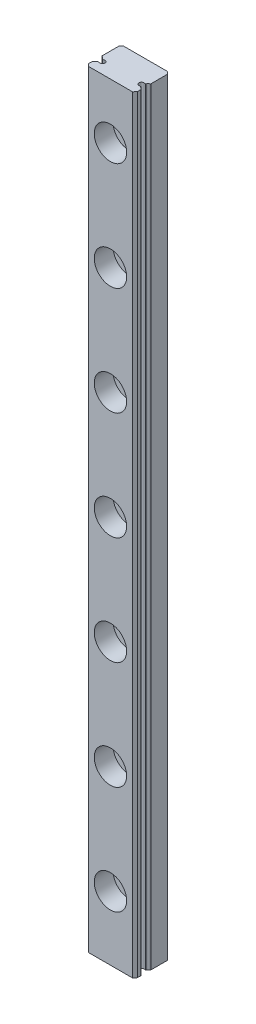
from build123d import *

# Parameters (mm, degrees)
RESSALTO_EXTRUS_O1_DEPTH                             = 1000
CORTE_EXTRUS_O1_START                                = -1000
CORTE_EXTRUS_O1_DEPTH                                = 1000
CORTE_EXTRUS_O2_DEPTH                                = 1001.031261626
CORTE_EXTRUS_O3_DEPTH                                = 1001.031261626
CORTE_EXTRUS_O4_DEPTH                                = 1001.031261626
CORTE_EXTRUS_O5_DEPTH                                = 0.002166667
CORTE_EXTRUS_O6_DEPTH                                = 0.002166667
CORTE_EXTRUS_O7_DEPTH                                = 0.002166667
CORTE_EXTRUS_O8_DEPTH                                = 0.002166667
INCLINA_O1_ANGLE                                     = 45.1469538
ESBO_O10_W                                           = 0.450000001
ESBO_O10_H                                           = 1000
REBAIXO_PARA_PARAFUSO_DE_M_QUINA_DE_CABE_D           = 3.5
REBAIXO_PARA_PARAFUSO_DE_M_QUINA_DE_CABE_CBORE_D     = 6
REBAIXO_PARA_PARAFUSO_DE_M_QUINA_DE_CABE_CBORE_DEPTH = 3.50000002
CHANFRO1_SIZE                                        = 0.062563219
CHANFRO1_SIZE2                                       = 0.062205617
CHANFRO3_START                                       = -3.730761794
CHANFRO3_DEPTH                                       = 0.399013115
CHANFRO4_SIZE                                        = 0.4
FILETE1_R                                            = 0.130000023
SKETCH1_W                                            = 36.072768502
SKETCH1_H                                            = 858.120887339
SKETCH1_W_2                                          = 21.632087489
SKETCH1_H_2                                          = 62.411000867
CUT_EXTRUDE1_DEPTH                                   = 10


with BuildPart() as part:
    # Esboço1 → Ressalto-extrusão1 (new body)
    with BuildSketch(Plane.XZ):
        with BuildLine():
            Line((4.5, 5.4097155), (4.5, 6.01167813))
            Line((4.5, 6.01167813), (4.1, 6.50000002))
            Line((4.1, 6.50000002), (-4.1, 6.50000002))
            Line((-4.1, 6.50000002), (-4.5, 6.01167813))
            Line((-4.5, 6.01167813), (-4.5, 2e-08))
            Line((-4.5, 2e-08), (4.5, 2e-08))
            Line((4.5, 2e-08), (4.5, 3.50196265))
            ThreePointArc((4.5, 3.50196265), (4.477413879, 3.553810372), (4.43494978, 3.59116167))
            ThreePointArc((4.43494978, 3.59116167), (3.930462682, 4.43021964), (4.43494978, 5.26927761))
            ThreePointArc((4.43494978, 5.26927761), (4.490651601, 5.328761203), (4.5, 5.4097155))
        make_face()
    extrude(amount=-RESSALTO_EXTRUS_O1_DEPTH)

    # Esboço2 → Corte-extrusão1 (cut)
    with BuildSketch(Plane(origin=(0, 1000, 0), x_dir=(-1, 0, 0), z_dir=(0, 1, 0)).offset(CORTE_EXTRUS_O1_START)):
        with BuildLine():
            Line((-4.030498711, 4.00588336), (-3.673447948, 4.00588336))
            ThreePointArc((-3.673447948, 4.00588336), (-3.223447946, 4.455883362), (-3.673447948, 4.905883363))
            Line((-3.673447948, 4.905883363), (-3.953580008, 4.905883363))
            ThreePointArc((-3.953580008, 4.905883363), (-4.010719931, 4.899199784), (-4.065149208, 4.917830263))
            ThreePointArc((-4.065149208, 4.917830263), (-3.93114763, 4.466290066), (-4.030498711, 4.00588336))
        make_face()
    extrude(amount=CORTE_EXTRUS_O1_DEPTH, mode=Mode.SUBTRACT)

    # Esboço3 → Corte-extrusão2 (cut, through all)
    with BuildSketch(Plane(origin=(0, 1000, 0), x_dir=(-1, 0, 0), z_dir=(0, 1, 0))):
        with BuildLine():
            Line((4.5, 4.03150278), (4.5, 4.88017535))
            Line((4.5, 4.88017535), (3.66946318, 4.88017535))
            ThreePointArc((3.66946318, 4.88017535), (3.969667593, 4.455839065), (3.66946318, 4.03150278))
            Line((3.66946318, 4.03150278), (4.5, 4.03150278))
        make_face()
    extrude(amount=-CORTE_EXTRUS_O2_DEPTH, mode=Mode.SUBTRACT)

    # Esboço4 → Corte-extrusão3 (cut, through all)
    with BuildSketch(Plane(origin=(0, 1000, 0), x_dir=(-1, 0, 0), z_dir=(0, 1, 0))):
        with BuildLine():
            Line((4.026513974, 4.88017535), (4.5, 4.88017535))
            Line((4.5, 4.88017535), (4.5, 5.328056964))
            ThreePointArc((4.5, 5.328056964), (4.223646078, 5.145991535), (4.026513974, 4.88017535))
        make_face()
    extrude(amount=-CORTE_EXTRUS_O3_DEPTH, mode=Mode.SUBTRACT)

    # Esboço5 → Corte-extrusão4 (cut, through all)
    with BuildSketch(Plane(origin=(0, 1000, 0), x_dir=(-1, 0, 0), z_dir=(0, 1, 0))):
        with BuildLine():
            Line((4.5, 3.583620931), (4.5, 4.03150278))
            Line((4.5, 4.03150278), (4.026513856, 4.03150278))
            ThreePointArc((4.026513856, 4.03150278), (4.223645982, 3.76568645), (4.5, 3.583620931))
        make_face()
    extrude(amount=-CORTE_EXTRUS_O4_DEPTH, mode=Mode.SUBTRACT)

    # Esboço6 → Corte-extrusão5 (cut)
    with BuildSketch(Plane(origin=(0, 1000, 0), x_dir=(-1, 0, 0), z_dir=(0, 1, 0))):
        Polygon((0.891369267, 3.403698133), (0.714701433, 3.168235633), (0.2187042, 2.61105), (1.0945792, 2.61105), (1.0945792, 2.695983333), (0.398689633, 2.695983333), (0.794326433, 3.149466667), (0.9743123, 3.3891), (1.067110588, 3.573407857), (0.95413722, 3.802321701), (0.7876908, 3.88505), (0.54301, 3.88505), (0.375434678, 3.803592619), (0.295011167, 3.6384023), (0.295011167, 3.562), (0.3812718, 3.562), (0.3812718, 3.631766667), (0.437672733, 3.743620833), (0.549645633, 3.800116667), (0.7802262, 3.800116667), (0.893028067, 3.743810633), (0.976240026, 3.576039029), align=None)
    extrude(amount=-CORTE_EXTRUS_O5_DEPTH, mode=Mode.SUBTRACT)

    # Esboço7 → Corte-extrusão6 (cut)
    with BuildSketch(Plane.XZ):
        Polygon((-0.214632167, 3.88505), (-0.953983333, 3.88505), (-0.953983333, 2.61105), (-0.214632167, 2.61105), (-0.214632167, 2.695983333), (-0.86905, 2.695983333), (-0.86905, 3.205583333), (-0.5123963, 3.205583333), (-0.5123963, 3.290516667), (-0.86905, 3.290516667), (-0.86905, 3.800116667), (-0.214632167, 3.800116667), align=None)
    extrude(amount=-CORTE_EXTRUS_O6_DEPTH, mode=Mode.SUBTRACT)

    # Esboço8 → Corte-extrusão7 (cut)
    with BuildSketch(Plane(origin=(0, 1000, 0), x_dir=(-1, 0, 0), z_dir=(0, 1, 0))):
        Polygon((-0.214632167, 3.88505), (-0.953983333, 3.88505), (-0.953983333, 2.61105), (-0.214632167, 2.61105), (-0.214632167, 2.695983333), (-0.86905, 2.695983333), (-0.86905, 3.205583333), (-0.5123963, 3.205583333), (-0.5123963, 3.290516667), (-0.86905, 3.290516667), (-0.86905, 3.800116667), (-0.214632167, 3.800116667), align=None)
    extrude(amount=-CORTE_EXTRUS_O7_DEPTH, mode=Mode.SUBTRACT)

    # Esboço9 → Corte-extrusão8 (cut)
    with BuildSketch(Plane.XZ):
        Polygon((0.510057167, 3.620830633), (0.6071, 3.718655633), (0.6071, 2.609403333), (0.692033333, 2.609403333), (0.692033333, 3.883403333), (0.6741176, 3.883403333), (0.6741176, 3.795069794), (0.3690544, 3.640736667), (0.3690544, 3.551253333), align=None)
    extrude(amount=-CORTE_EXTRUS_O8_DEPTH, mode=Mode.SUBTRACT)

    # Inclinação1
    inclina_o1_faces = [part.faces().sort_by_distance(p)[0] for p in [
        (0.6741176, 0.001083333, 3.839236564),
    ]]
    draft(inclina_o1_faces, Plane(origin=(0.692033333, 0.002166667, 3.883403333), x_dir=(-1, 0, 0), z_dir=(0, 0, -1)), INCLINA_O1_ANGLE)

    # Esboço10 → Corte-Revolução1 (revolve, cut)
    with BuildSketch(Plane.XY.offset(4.455839065)):
        with Locations((-3.294667591, 500)):
            Rectangle(ESBO_O10_W, ESBO_O10_H)
    revolve(axis=Axis((-3.519667591, 1000, 4.455839065), (0, -1, 0)), mode=Mode.SUBTRACT)

    # Rebaixo para parafuso de máquina de cabeça sextavada de M31 (through all)
    with Locations(Plane.XY.offset(6.50000002)):
        with Locations((0, 990), (0, 970), (0, 950), (0, 930), (0, 910), (0, 890), (0, 870), (0, 850), (0, 830), (0, 810), (0, 790), (0, 770), (0, 750), (0, 730), (0, 710), (0, 690), (0, 670), (0, 650), (0, 630), (0, 610), (0, 590), (0, 570), (0, 550), (0, 530), (0, 510), (0, 490), (0, 470), (0, 450), (0, 430), (0, 410), (0, 390), (0, 370), (0, 350), (0, 330), (0, 310), (0, 290), (0, 270), (0, 250), (0, 230), (0, 210), (0, 190), (0, 170), (0, 150), (0, 130), (0, 110), (0, 90), (0, 70), (0, 50), (0, 30), (0, 10)):
            CounterBoreHole(REBAIXO_PARA_PARAFUSO_DE_M_QUINA_DE_CABE_D / 2, REBAIXO_PARA_PARAFUSO_DE_M_QUINA_DE_CABE_CBORE_D / 2, REBAIXO_PARA_PARAFUSO_DE_M_QUINA_DE_CABE_CBORE_DEPTH)

    # Chanfro1
    chanfro1_edges = [part.edges().sort_by_distance(p)[0] for p in [
        (-0.976240026, 999.998916667, 3.576039029),
    ]]
    chanfro1_side = [part.faces().sort_by_distance(p)[0] for p in [
        (-0.933804646, 999.998916667, 3.489868581),
    ]]
    chamfer(chanfro1_edges, length=CHANFRO1_SIZE, length2=CHANFRO1_SIZE2, reference=chanfro1_side[0])

    # Chanfro3: read off the stored shape, not the designer's step
    # Chanfro3 outline → Chanfro3 (add)
    with BuildSketch(Plane(origin=(0, 0, 0), x_dir=(0.8991051825477068, 0, 0.43773264753254887), z_dir=(0.4377326475325489, 0, -0.8991051825477069)).offset(CHANFRO3_START)):
        Polygon((1.327401403, -999.997833333), (1.31122788, -999.997833333), (1.311999664, -1000), (1.327401403, -1000), align=None)
    extrude(amount=CHANFRO3_DEPTH)

    # Chanfro4
    chanfro4_edges = [part.edges().sort_by_distance(p)[0] for p in [
        (4.5, 500, 2e-08),
        (-4.5, 500, 2e-08),
    ]]
    chamfer(chanfro4_edges, length=CHANFRO4_SIZE)

    # Filete1
    filete1_edges = [part.edges().sort_by_distance(p)[0] for p in [
        (4.030498711, 500, 4.00588336),
        (-4.026513974, 500, 4.88017535),
        (-4.5, 500, 5.328056964),
        (-4.5, 500, 3.583620931),
        (-4.026513856, 500, 4.03150278),
    ]]
    fillet(filete1_edges, radius=FILETE1_R)

    # Sketch1 → Cut-Extrude1 (cut)
    with BuildSketch(Plane(origin=(0, 0, 0), x_dir=(-1, 0, 0), z_dir=(0, 0, -1))):
        with Locations((-9.39117436, 589.29269367)):
            Rectangle(SKETCH1_W, SKETCH1_H)
        with Locations((0.25600221, -13.052857141)):
            Rectangle(SKETCH1_W_2, SKETCH1_H_2)
    extrude(amount=-CUT_EXTRUDE1_DEPTH, mode=Mode.SUBTRACT)


solid = part.part
